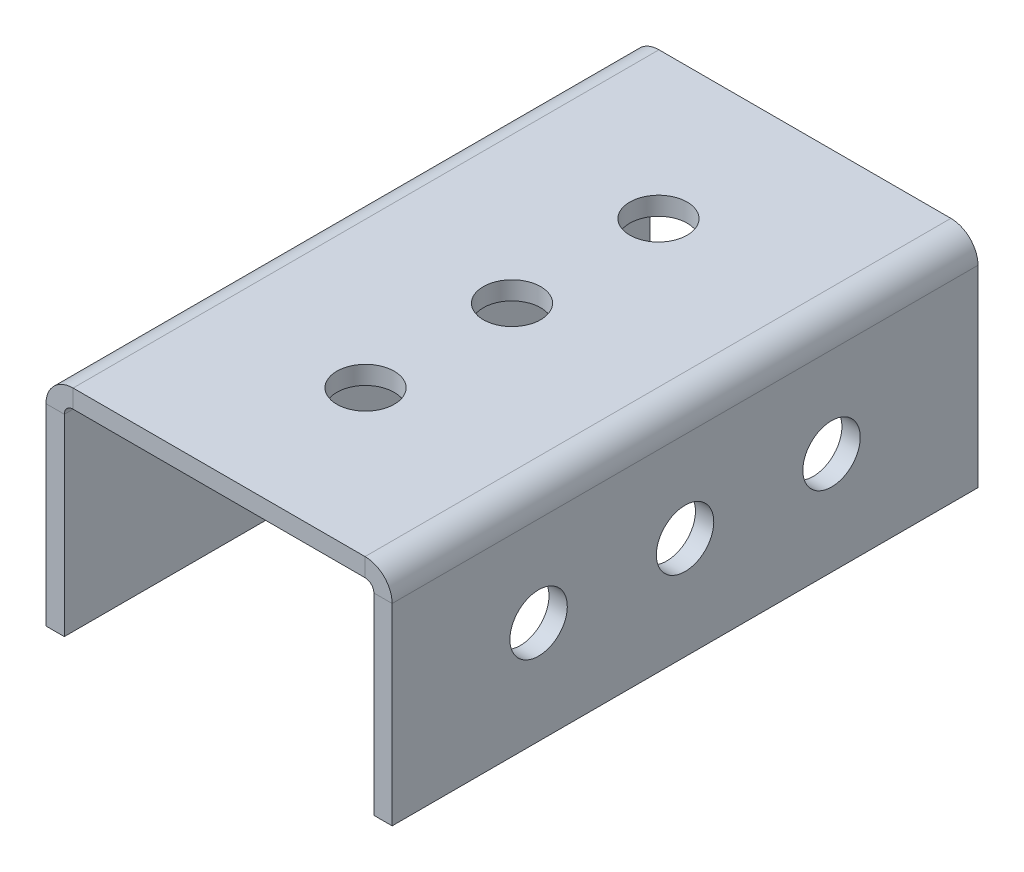
from build123d import *

# Parameters (mm, degrees)
BASE_FLANGE1_DEPTH = 50.8
SKETCH6_R          = 2.4892
CUT_EXTRUDE1_DEPTH = 63.002427854
SKETCH7_R          = 2.4892
CUT_EXTRUDE2_DEPTH = 57.291492607


# Sheet-metal steps are written as plain solids
with BuildPart() as part:
    # Sketch1 → Base-Flange1 (new body)
    with BuildSketch(Plane.XY):
        with BuildLine():
            Line((-15.00632, 0), (-15.00632, 16.7005))
            ThreePointArc((-15.00632, 16.7005), (-14.318167382, 18.361847382), (-12.65682, 19.05))
            Line((-12.65682, 19.05), (12.65682, 19.05))
            ThreePointArc((12.65682, 19.05), (14.318167382, 18.361847382), (15.00632, 16.7005))
            Line((15.00632, 16.7005), (15.00632, 0))
            Line((15.00632, 0), (13.41882, 0))
            Line((13.41882, 0), (13.41882, 16.7005))
            ThreePointArc((13.41882, 16.7005), (13.195635367, 17.239315367), (12.65682, 17.4625))
            Line((12.65682, 17.4625), (-12.65682, 17.4625))
            ThreePointArc((-12.65682, 17.4625), (-13.195635367, 17.239315367), (-13.41882, 16.7005))
            Line((-13.41882, 16.7005), (-13.41882, 0))
            Line((-13.41882, 0), (-15.00632, 0))
        make_face()
    extrude(amount=BASE_FLANGE1_DEPTH)

    # Sketch6 → Cut-Extrude1 (cut, through all)
    with BuildSketch(Plane(origin=(15.00632, 0, 0), x_dir=(0, 0, -1), z_dir=(1, 0, 0))):
        with Locations(Location((-25.4, 8.89, 0), (0, 0, 90))):
            Circle(SKETCH6_R)
        with Locations(Location((-38.1, 8.89, 0), (0, 0, 90))):
            Circle(SKETCH6_R)
        with Locations(Location((-12.7, 8.89, 0), (0, 0, 90))):
            Circle(SKETCH6_R)
    extrude(amount=-CUT_EXTRUDE1_DEPTH, mode=Mode.SUBTRACT)

    # Sketch7 → Cut-Extrude2 (cut, through all)
    with BuildSketch(Plane(origin=(0, 19.05, 0), x_dir=(1, 0, 0), z_dir=(0, 1, 0))):
        with Locations(Location((0, -12.7, 0), (0, 0, 180))):
            Circle(SKETCH7_R)
        with Locations(Location((0, -25.4, 0), (0, 0, 180))):
            Circle(SKETCH7_R)
        with Locations(Location((0, -38.1, 0), (0, 0, 180))):
            Circle(SKETCH7_R)
    extrude(amount=-CUT_EXTRUDE2_DEPTH, mode=Mode.SUBTRACT)


solid = part.part
